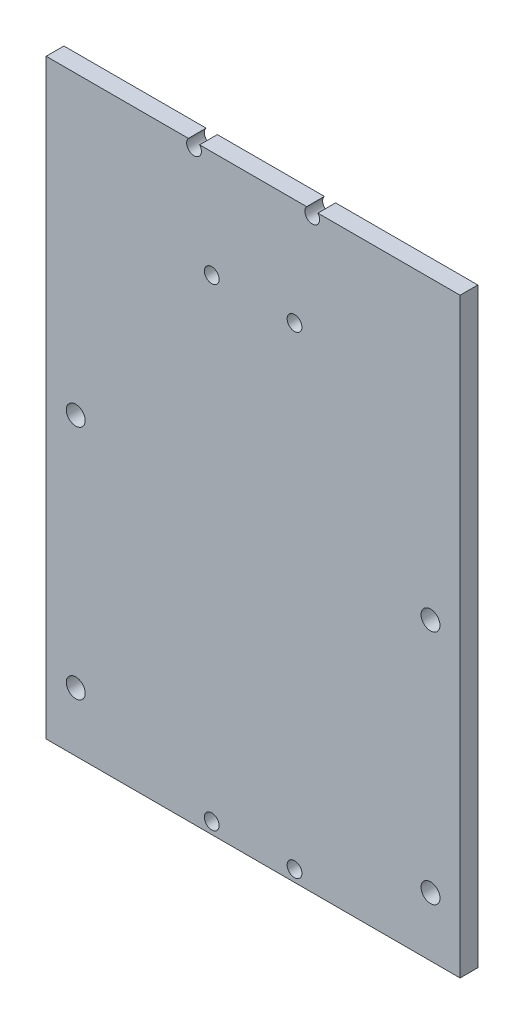
from build123d import *

# Parameters (mm, degrees)
SKETCH_1_W          = 70
SKETCH_1_H          = 100
EXTRUDE_1_DEPTH     = 3
SKETCH_2_R          = 1.6
CUT_EXTRUDE_1_DEPTH = 3
SKETCH_3_R          = 1.25
CUT_EXTRUDE_2_DEPTH = 3


with BuildPart() as part:
    # 草图1 → 凸台-拉伸1 (new body)
    with BuildSketch(Plane.XY):
        with Locations((-44.233232324, 72.350653578)):
            Rectangle(SKETCH_1_W, SKETCH_1_H)
    extrude(amount=EXTRUDE_1_DEPTH)

    # 草图2 → 切除-拉伸1 (cut)
    with BuildSketch(Plane.XY.offset(3)):
        with Locations((-74.233232324, 32.350653578)):
            Circle(SKETCH_2_R)
        with Locations((-14.233232324, 32.350653578)):
            Circle(SKETCH_2_R)
        with Locations((-14.233232324, 72.286219849)):
            Circle(SKETCH_2_R)
        with Locations((-74.233232324, 72.286219849)):
            Circle(SKETCH_2_R)
    extrude(amount=-CUT_EXTRUDE_1_DEPTH, mode=Mode.SUBTRACT)

    # 草图3 → 切除-拉伸2 (cut)
    with BuildSketch(Plane(origin=(0, 0, 0), x_dir=(-1, 0, 0), z_dir=(0, 0, -1))):
        with Locations((37.233066324, 104.286219849)):
            Circle(SKETCH_3_R)
        with Locations((51.233066324, 104.286219849)):
            Circle(SKETCH_3_R)
        with Locations((37.233066324, 24.286219849)):
            Circle(SKETCH_3_R)
        with Locations((51.233066324, 24.286219849)):
            Circle(SKETCH_3_R)
        with Locations((34.233232324, 121.536231848)):
            Circle(SKETCH_3_R)
        with Locations((54.233232324, 121.536231848)):
            Circle(SKETCH_3_R)
    extrude(amount=-CUT_EXTRUDE_2_DEPTH, mode=Mode.SUBTRACT)


solid = part.part
